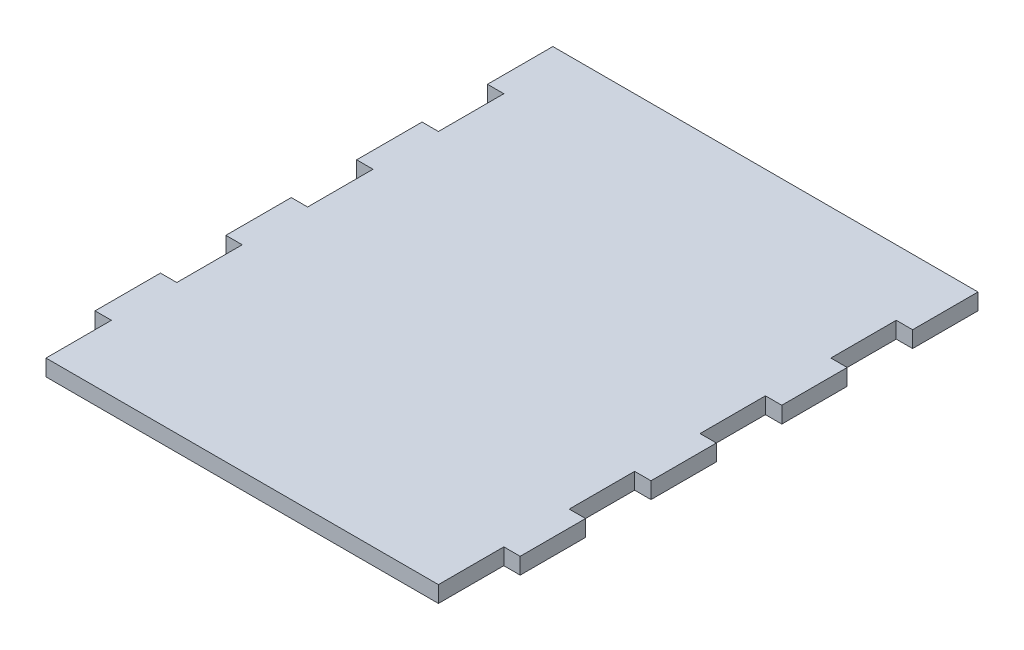
from build123d import *

# Parameters (mm, degrees)
BOSS_EXTRUDE1_DEPTH = 3.175


with BuildPart() as part:
    # Sketch1 → Boss-Extrude1 (new body)
    with BuildSketch(Plane(origin=(0, 0, 0), x_dir=(1, 0, 0), z_dir=(0, 1, 0))):
        Polygon((0, 0), (76.2, 0), (76.2, 12.7), (79.375, 12.7), (79.375, 25.4), (76.2, 25.4), (76.2, 38.1), (79.375, 38.1), (79.375, 50.8), (76.2, 50.8), (76.2, 63.5), (79.375, 63.5), (79.375, 76.2), (76.2, 76.2), (76.2, 88.9), (79.375, 88.9), (79.375, 101.6), (-3.175, 101.6), (-3.175, 88.9), (0, 88.9), (0, 76.2), (-3.175, 76.2), (-3.175, 63.5), (0, 63.5), (0, 50.8), (-3.175, 50.8), (-3.175, 38.1), (0, 38.1), (0, 25.4), (-3.175, 25.4), (-3.175, 12.7), (0, 12.7), align=None)
    extrude(amount=BOSS_EXTRUDE1_DEPTH)


solid = part.part
